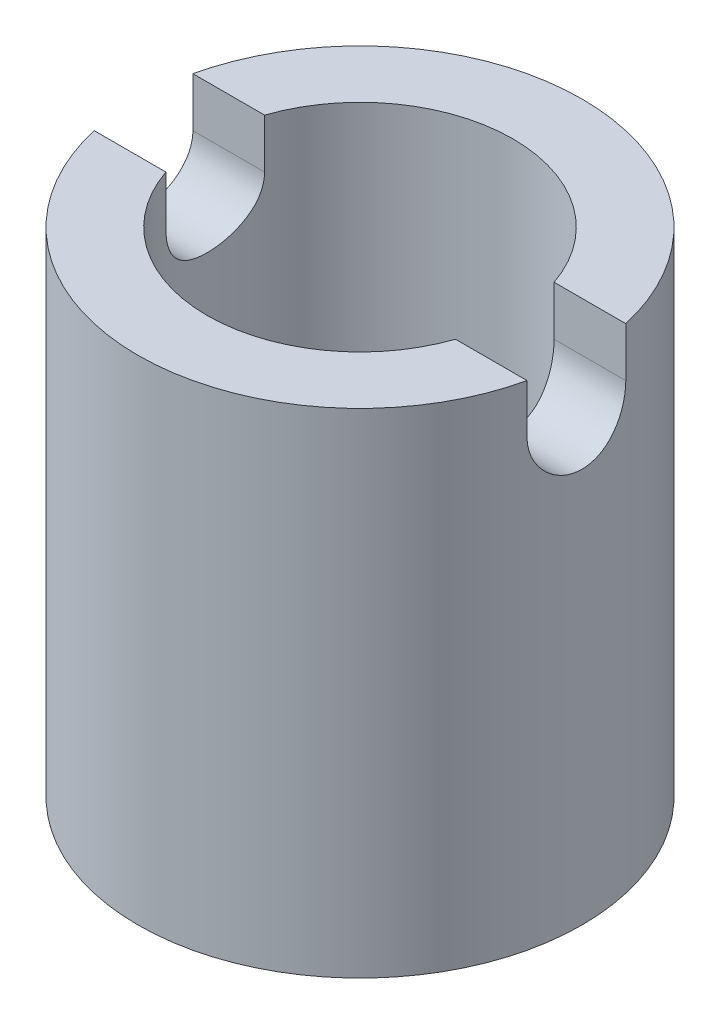
from build123d import *
from build123d.topology import SkipClean

# Parameters (mm, degrees)
SKETCH_1_R               = 4.5
SKETCH_1_R_2             = 3
EXTRUDE_1_DEPTH          = 9
CUT_EXTRUDE_3_DEPTH      = 12.022703843
CUT_EXTRUDE_3_DEPTH_BACK = 12.022703843
SKETCH_2_R               = 1
EXTRUDE_2_DEPTH          = 1
MOVE_FACE_1_OUTLINE_R    = 3.1
MOVE_FACE_1_OUTLINE_R_2  = 3
MOVE_FACE_1_DEPTH        = 10


# Read off the part's stored shape, not the designer's step: 面の移動1
with BuildPart() as part:
    # ｽｹｯﾁ1 → ﾎﾞｽ - 押し出し1 (new body)
    with BuildSketch(Plane(origin=(0, 0, 0), x_dir=(1, 0, 0), z_dir=(0, 1, 0))):
        with Locations(Location((0, 0, 0), (0, 0, 270))):
            Circle(SKETCH_1_R)
        with Locations(Location((0, 0, 0), (0, 0, 270))):
            Circle(SKETCH_1_R_2, mode=Mode.SUBTRACT)
    extrude(amount=EXTRUDE_1_DEPTH)

    # ｽｹｯﾁ2 → ｶｯﾄ - 押し出し3 (cut, two sides: drawn at the far end of the back side and taken through both)
    with BuildSketch(Plane(origin=(0, 0, 0), x_dir=(0, 0, -1), z_dir=(1, 0, 0)).offset(-CUT_EXTRUDE_3_DEPTH_BACK)):
        with Locations((0, 9)):
            Circle(SKETCH_2_R)
    extrude(amount=CUT_EXTRUDE_3_DEPTH + CUT_EXTRUDE_3_DEPTH_BACK, mode=Mode.SUBTRACT)

    # ｽｹｯﾁ3 → ﾎﾞｽ - 押し出し2 (add)
    with SkipClean():  # the faces are left unmerged after this step: merging them gives an invalid solid
        with BuildSketch(Plane(origin=(0, 9, 0), x_dir=(1, 0, 0), z_dir=(0, 1, 0))):
            with BuildLine():
                Line((-2.828427125, -1), (-4.387482194, -1))
                ThreePointArc((-4.387482194, -1), (0, -4.5), (4.387482194, -1))
                Line((4.387482194, -1), (2.828427125, -1))
                ThreePointArc((2.828427125, -1), (0, -3), (-2.828427125, -1))
            make_face()
            with BuildLine():
                Line((2.828427125, 1), (4.387482194, 1))
                ThreePointArc((4.387482194, 1), (0, 4.5), (-4.387482194, 1))
                Line((-4.387482194, 1), (-2.828427125, 1))
                ThreePointArc((-2.828427125, 1), (0, 3), (2.828427125, 1))
            make_face()
        extrude(amount=EXTRUDE_2_DEPTH)

    # Move Face 1 outline → Move Face 1 (cut)
    with BuildSketch(Plane(origin=(0, 0, 0), x_dir=(1, 0, 0), z_dir=(0, 1, 0))):
        Circle(MOVE_FACE_1_OUTLINE_R)
        Circle(MOVE_FACE_1_OUTLINE_R_2, mode=Mode.SUBTRACT)
    extrude(amount=MOVE_FACE_1_DEPTH, mode=Mode.SUBTRACT)


solid = part.part
